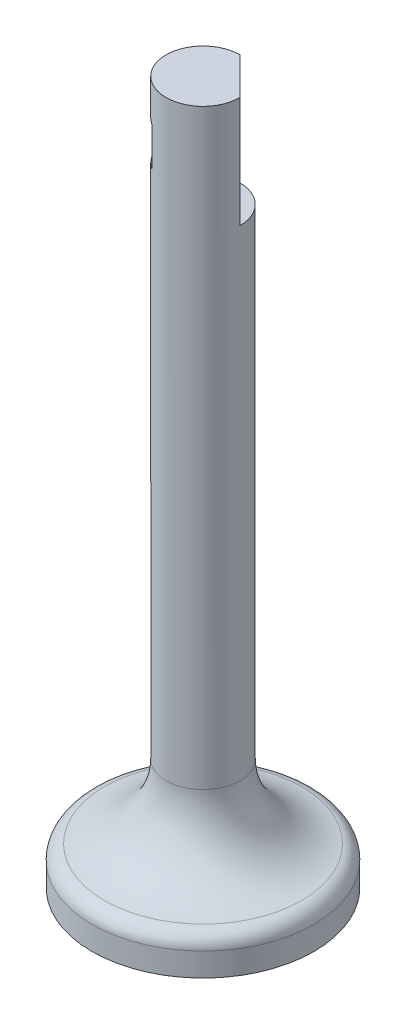
from build123d import *

# Parameters (mm, degrees)
SKETCH1_R           = 15
BOSS_EXTRUDE1_DEPTH = 5
SKETCH2_R           = 5
BOSS_EXTRUDE2_DEPTH = 90
CUT_EXTRUDE1_START  = -15
CUT_EXTRUDE1_DEPTH  = 15
SKETCH4_W           = 2
SKETCH4_H           = 5.2
CUT_EXTRUDE2_DEPTH  = 99.17076958
FILLET1_R           = 10
FILLET2_R           = 2
CUT_EXTRUDE3_DEPTH  = 1
SKETCH6_R           = 13.5
SKETCH6_R_2         = 11.5
CUT_EXTRUDE4_DEPTH  = 1


with BuildPart() as part:
    # Sketch1 → Boss-Extrude1 (new body)
    with BuildSketch(Plane(origin=(0, 0, 0), x_dir=(1, 0, 0), z_dir=(0, 1, 0))):
        with Locations(Location((0, 0, 0), (0, 0, 270))):
            Circle(SKETCH1_R)
    extrude(amount=BOSS_EXTRUDE1_DEPTH)

    # Sketch2 → Boss-Extrude2 (add)
    with BuildSketch(Plane(origin=(0, 5, 0), x_dir=(1, 0, 0), z_dir=(0, 1, 0))):
        with Locations(Location((0, 0, 0), (0, 0, 90))):
            Circle(SKETCH2_R)
    extrude(amount=BOSS_EXTRUDE2_DEPTH)

    # Sketch3 → Cut-Extrude1 (cut)
    with BuildSketch(Plane(origin=(0, 95, 0), x_dir=(1, 0, 0), z_dir=(0, 1, 0)).offset(CUT_EXTRUDE1_START)):
        with BuildLine():
            Line((0, 5), (5, 0))
            ThreePointArc((5, 0), (3.535533906, 3.535533906), (0, 5))
        make_face()
    extrude(amount=CUT_EXTRUDE1_DEPTH, mode=Mode.SUBTRACT)

    # Sketch4 → Cut-Extrude2 (cut, through all)
    with BuildSketch(Plane(origin=(2.5, 0, -2.5), x_dir=(-0.7071067811865475, 0, -0.7071067811865477), z_dir=(0.7071067811865477, 0, -0.7071067811865475))):
        with Locations((0, 87.5)):
            Rectangle(SKETCH4_W, SKETCH4_H)
    extrude(amount=-CUT_EXTRUDE2_DEPTH, mode=Mode.SUBTRACT)

    # Fillet1
    fillet1_edges = [part.edges().sort_by_distance(p)[0] for p in [
        (0, 5, 5),
    ]]
    fillet(fillet1_edges, radius=FILLET1_R - 0.0001)  # a hair under: the kernel refuses the full size

    # Fillet2
    fillet2_edges = [part.edges().sort_by_distance(p)[0] for p in [
        (0, 5, -15),
    ]]
    fillet(fillet2_edges, radius=FILLET2_R)

    # Sketch5 → Cut-Extrude3 (cut)
    with BuildSketch(Plane.XZ):
        with BuildLine():
            Line((-1.637065711, 9.676642787), (9.523190699, -1.483613623))
            Line((9.523190699, -1.483613623), (5.311652237, -5.695152084))
            add(Edge.make_bspline(
                [(5.311652237, -5.695152084), (5.222138514, -5.784060594), (5.04738551, -5.957632072), (4.789980879, -6.205637327), (4.545170464, -6.434144406), (4.314659572, -6.644098006), (4.09362148, -6.830927906), (3.889758382, -7.002719589), (3.69565283, -7.150200035), (3.570345293, -7.241295339), (3.510370186, -7.284895674)],
                knots=[0, 0, 0, 0, 1.258886347, 2.457658598, 3.566401057, 4.600468819, 5.568286539, 6.454134328, 7.260112675, 8, 8, 8, 8], degree=3))
            add(Edge.make_bspline(
                [(3.510370186, -7.284895674), (3.352057488, -7.391657893), (3.045888719, -7.598130638), (2.566454347, -7.848616029), (2.088709315, -8.031605789), (1.611555846, -8.155041162), (1.129098311, -8.206051584), (0.637891361, -8.192108975), (0.134888923, -8.11428248), (-0.372633356, -7.969030769), (-0.872601546, -7.763082396), (-1.351797855, -7.491862034), (-1.809467136, -7.167166368), (-2.084445811, -6.906961882), (-2.223604173, -6.775280289)],
                knots=[0, 0, 0, 0, 1.085817505, 2.099916266, 3.069631314, 3.991048598, 4.895916369, 5.820176367, 6.779587027, 7.784039251, 8.816928408, 9.848367769, 10.911124231, 12, 12, 12, 12], degree=3))
            add(Edge.make_bspline(
                [(-2.223604173, -6.775280289), (-2.336734542, -6.656352184), (-2.56008707, -6.421553226), (-2.855775684, -6.042833727), (-3.106227984, -5.64686054), (-3.315994358, -5.238308237), (-3.484073648, -4.815633421), (-3.609745523, -4.377562245), (-3.691600055, -3.924500762), (-3.737830146, -3.456793519), (-3.718915595, -2.972046746), (-3.62400832, -2.471794707), (-3.445196287, -1.960272191), (-3.195874633, -1.431943292), (-2.869308405, -0.889700641), (-2.464234681, -0.334885684), (-1.986644206, 0.236940057), (-1.625835114, 0.606436234), (-1.438347763, 0.798437659)],
                knots=[0, 0, 0, 0, 0.905918046, 1.788547915, 2.647703894, 3.489284766, 4.320694788, 5.155279578, 6.001046779, 6.859817908, 7.745360365, 8.669757575, 9.660298499, 10.729041634, 11.890420876, 13.149445516, 14.5187654, 16, 16, 16, 16], degree=3))
            Line((-1.438347763, 0.798437659), (1.423831724, 3.660617146))
            Line((1.423831724, 3.660617146), (-3.114629814, 8.199078685))
            Line((-3.114629814, 8.199078685), (-1.637065711, 9.676642787))
        make_face()
        with BuildLine():
            Line((2.737934289, 2.346514582), (-0.146681096, -0.538100802))
            add(Edge.make_bspline(
                [(-0.146681096, -0.538100802), (-0.260313381, -0.65428127), (-0.479959168, -0.878852573), (-0.773260091, -1.224420889), (-1.027081256, -1.559053853), (-1.234921637, -1.885549874), (-1.405033378, -2.201516333), (-1.532005524, -2.509259236), (-1.61338181, -2.809868657), (-1.653183343, -3.102018529), (-1.651825971, -3.386261795), (-1.620270356, -3.663837107), (-1.554866401, -3.935764915), (-1.458636403, -4.202624086), (-1.328091019, -4.463959906), (-1.167765432, -4.721763246), (-0.971104209, -4.971210552), (-0.822117923, -5.127940531), (-0.74604007, -5.207972597)],
                knots=[0, 0, 0, 0, 1.445903498, 2.794862496, 4.030928865, 5.180949829, 6.23580341, 7.221038598, 8.136693834, 9.000005142, 9.836726991, 10.659941899, 11.480957457, 12.32010686, 13.179061295, 14.076063356, 15.017567502, 16, 16, 16, 16], degree=3))
            add(Edge.make_bspline(
                [(-0.74604007, -5.207972597), (-0.6293357, -5.316302566), (-0.402138795, -5.527196413), (-0.019259163, -5.776250817), (0.382841414, -5.956890263), (0.800723528, -6.060399706), (1.219698662, -6.102803811), (1.630125751, -6.06432865), (2.028390936, -5.964880448), (2.271917157, -5.841059549), (2.394985571, -5.778485418)],
                knots=[0, 0, 0, 0, 1.110082986, 2.161079462, 3.172912607, 4.173354109, 5.154591278, 6.098016453, 7.038813575, 8, 8, 8, 8], degree=3))
            add(Edge.make_bspline(
                [(2.394985571, -5.778485418), (2.438170358, -5.752446879), (2.531164584, -5.696375427), (2.67205046, -5.59014108), (2.83334386, -5.466586503), (3.006975281, -5.314717262), (3.201771433, -5.144293582), (3.410529337, -4.950105092), (3.637256703, -4.7334163), (3.791622967, -4.580044579), (3.872549673, -4.499639264)],
                knots=[0, 0, 0, 0, 0.617675747, 1.330104431, 2.160457084, 3.107811318, 4.156123608, 5.332972174, 6.601807352, 8, 8, 8, 8], degree=3))
            Line((3.872549673, -4.499639264), (6.728318904, -1.643870033))
            Line((6.728318904, -1.643870033), (2.737934289, 2.346514582))
        make_face(mode=Mode.SUBTRACT)
    extrude(amount=-CUT_EXTRUDE3_DEPTH, mode=Mode.SUBTRACT)

    # Sketch6 → Cut-Extrude4 (cut)
    with BuildSketch(Plane.XZ):
        with Locations(Location((0, 0, 0), (0, 0, 270))):
            Circle(SKETCH6_R)
        with Locations(Location((0, 0, 0), (0, 0, 270))):
            Circle(SKETCH6_R_2, mode=Mode.SUBTRACT)
    extrude(amount=-CUT_EXTRUDE4_DEPTH, mode=Mode.SUBTRACT)


solid = part.part
